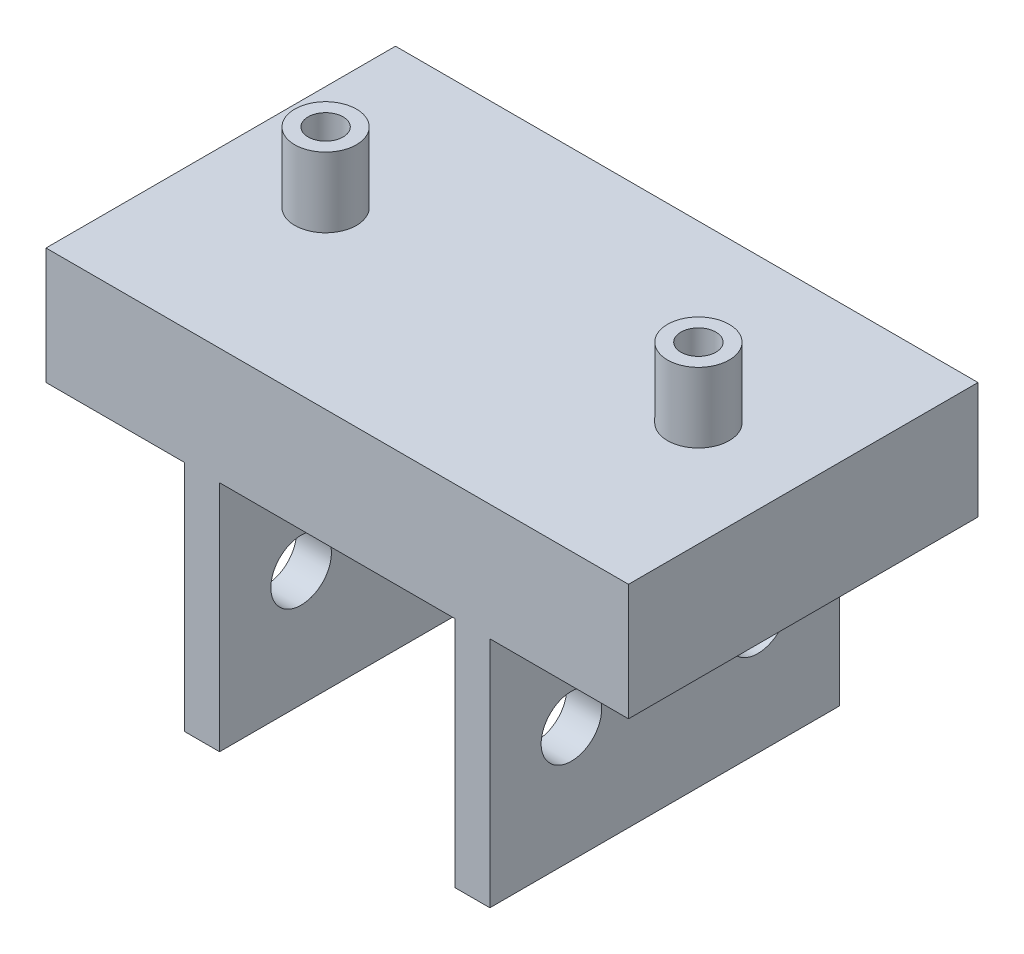
from build123d import *

# Parameters (mm, degrees)
EXTRUDE_1_DEPTH          = 30
SKETCH_2_R               = 2.6
CUT_EXTRUDE_1_DEPTH      = 55.558317423
CUT_EXTRUDE_2_DEPTH      = 50.244289009
CUT_EXTRUDE_2_DEPTH_BACK = 50.244289009
SKETCH_3_R               = 1.5
SKETCH_4_W               = 10
SKETCH_4_H               = 6
CUT_EXTRUDE_3_DEPTH      = 55.558317423
EXTRUDE_START            = 6
SKETCH_5_R               = 2.65
SKETCH_5_R_2             = 1.5
EXTRUDE_2_DEPTH          = 6


with BuildPart() as part:
    # 草图1 → 凸台-拉伸1 (new body)
    with BuildSketch(Plane.XY):
        Polygon((-25, -5), (-13.1, -5), (-13.1, -25), (-10.1, -25), (-10.1, -5), (10.1, -5), (10.1, -25), (13.1, -25), (13.1, -5), (25, -5), (25, 5), (-25, 5), align=None)
    extrude(amount=EXTRUDE_1_DEPTH)

    # 草图2 → 切除-拉伸1 (cut, through all)
    with BuildSketch(Plane(origin=(13.1, 0, 0), x_dir=(0, 0, -1), z_dir=(1, 0, 0))):
        with Locations((-23, -15)):
            Circle(SKETCH_2_R)
        with Locations((-7, -15)):
            Circle(SKETCH_2_R)
    extrude(amount=-CUT_EXTRUDE_1_DEPTH, mode=Mode.SUBTRACT)

    # 草图3 → 切除-拉伸2 (cut, two sides: drawn at the far end of the back side and taken through both)
    with BuildSketch(Plane(origin=(0, 5, 0), x_dir=(1, 0, 0), z_dir=(0, 1, 0)).offset(-CUT_EXTRUDE_2_DEPTH_BACK)):
        with Locations((16, -15)):
            Circle(SKETCH_3_R)
        with Locations((-16, -15)):
            Circle(SKETCH_3_R)
    extrude(amount=CUT_EXTRUDE_2_DEPTH + CUT_EXTRUDE_2_DEPTH_BACK, mode=Mode.SUBTRACT)

    # 草图4 → 切除-拉伸3 (cut, through all)
    with BuildSketch(Plane(origin=(13.1, 0, 0), x_dir=(0, 0, -1), z_dir=(1, 0, 0))):
        with Locations((-15, -8)):
            Rectangle(SKETCH_4_W, SKETCH_4_H)
    extrude(amount=-CUT_EXTRUDE_3_DEPTH, mode=Mode.SUBTRACT)

    # 草图5 → 凸台-拉伸2 (add)
    # profile 1 of 2: a face of its own
    with BuildSketch(Plane(origin=(0, 5, 0), x_dir=(1, 0, 0), z_dir=(0, 1, 0)).offset(EXTRUDE_START)):
        with Locations((16, -15)):
            Circle(SKETCH_5_R)
        with Locations((16, -15)):
            Circle(SKETCH_5_R_2, mode=Mode.SUBTRACT)
    # profile 2 of 2: a face of its own
    with BuildSketch(Plane(origin=(0, 5, 0), x_dir=(1, 0, 0), z_dir=(0, 1, 0)).offset(EXTRUDE_START)):
        with Locations((-16, -15)):
            Circle(SKETCH_5_R)
        with Locations((-16, -15)):
            Circle(SKETCH_5_R_2, mode=Mode.SUBTRACT)
    extrude(amount=-EXTRUDE_2_DEPTH)


solid = part.part
